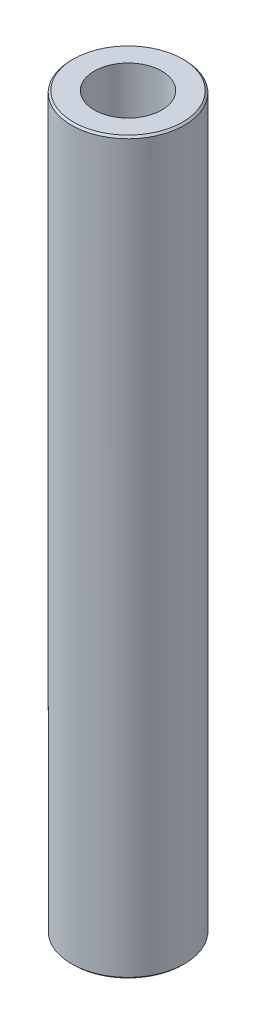
from build123d import *

# Parameters (mm, degrees)
SKETCH1_R           = 37.5
BOSS_EXTRUDE1_DEPTH = 484.537605118
SKETCH2_R           = 22.4098354
CUT_EXTRUDE1_DEPTH  = 488.431216454
CHAMFER1_SIZE       = 1.236573667


with BuildPart() as part:
    # Sketch1 → Boss-Extrude1 (new body)
    with BuildSketch(Plane(origin=(0, 0, 0), x_dir=(1, 0, 0), z_dir=(0, 1, 0))):
        Circle(SKETCH1_R)
    extrude(amount=BOSS_EXTRUDE1_DEPTH)

    # Sketch2 → Cut-Extrude1 (cut, through all)
    with BuildSketch(Plane(origin=(0, 0, 0), x_dir=(1, 0, 0), z_dir=(0, 1, 0))):
        Circle(SKETCH2_R)
    extrude(amount=CUT_EXTRUDE1_DEPTH, mode=Mode.SUBTRACT)

    # Chamfer1
    chamfer1_edges = [part.edges().sort_by_distance(p)[0] for p in [
        (-37.5, 484.537605118, 0),
        (-37.5, 0, 0),
    ]]
    chamfer(chamfer1_edges, length=CHAMFER1_SIZE)


solid = part.part
